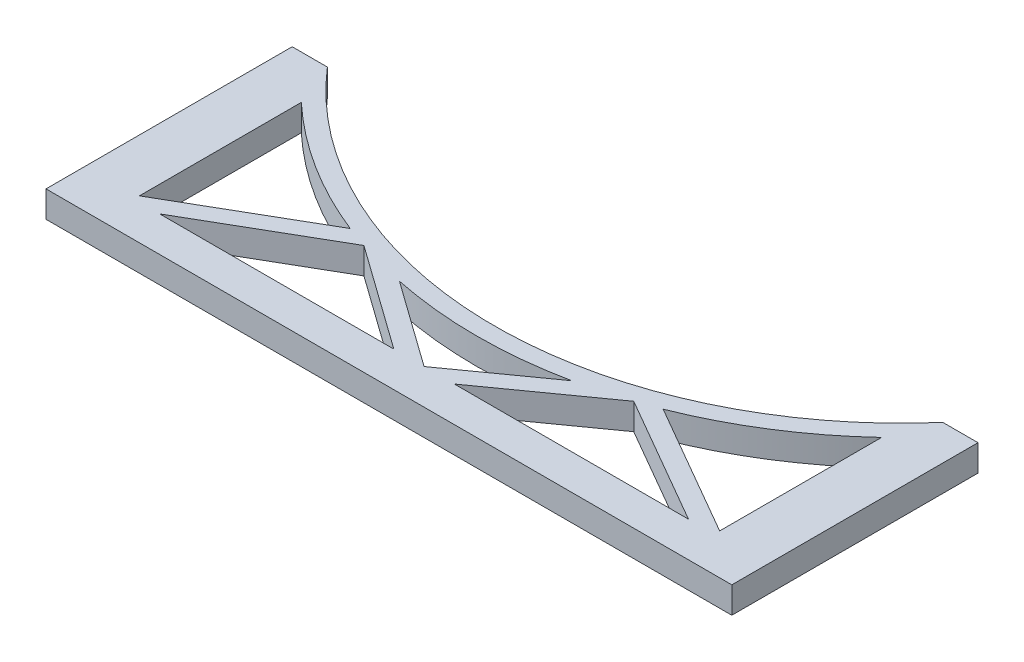
from build123d import *

# Parameters (mm, degrees)
BOSS_EXTRUDE1_DEPTH = 9.525
CUT_EXTRUDE1_DEPTH  = 153.730371079


with BuildPart() as part:
    # Sketch1 → Boss-Extrude1 (new body)
    with BuildSketch(Plane(origin=(0, 0, 0), x_dir=(1, 0, 0), z_dir=(0, 1, 0))):
        with BuildLine():
            Line((-123.825, 88.9), (-111.125, 88.9))
            ThreePointArc((-111.125, 88.9), (0, 38.1), (111.125, 88.9))
            Line((111.125, 88.9), (123.825, 88.9))
            Line((123.825, 88.9), (123.825, 0))
            Line((123.825, 0), (-123.825, 0))
            Line((-123.825, 0), (-123.825, 88.9))
        make_face()
    extrude(amount=BOSS_EXTRUDE1_DEPTH)

    # Sketch2 → Cut-Extrude1 (cut, through all)
    with BuildSketch(Plane(origin=(0, 9.525, 0), x_dir=(1, 0, 0), z_dir=(0, 1, 0))):
        with BuildLine():
            Line((-104.775, 73.145990939), (-104.775, 14.664696837))
            Line((-104.775, 14.664696837), (-56.4939766, 42.539758694))
            ThreePointArc((-56.4939766, 42.539758694), (-82.073784282, 55.572399887), (-104.775, 73.145990939))
        make_face()
        Polygon((-95.477954744, 12.7), (-10.9243238, 12.7), (-48.71725749, 39.697301147), align=None)
        with BuildLine():
            Line((0, 12.7), (-31.142812336, 34.946801217))
            ThreePointArc((-31.142812336, 34.946801217), (-15.653228886, 32.551294572), (0, 31.75))
            Line((0, 31.75), (0, 12.7))
        make_face()
    cut_extrude1 = extrude(amount=-CUT_EXTRUDE1_DEPTH, mode=Mode.SUBTRACT)

    # Mirror1: Cut-Extrude1 across plane
    add(cut_extrude1.mirror(Plane(origin=(0, 0, 0), x_dir=(0, 0, 1), z_dir=(1, 0, 0))), mode=Mode.SUBTRACT)


solid = part.part
